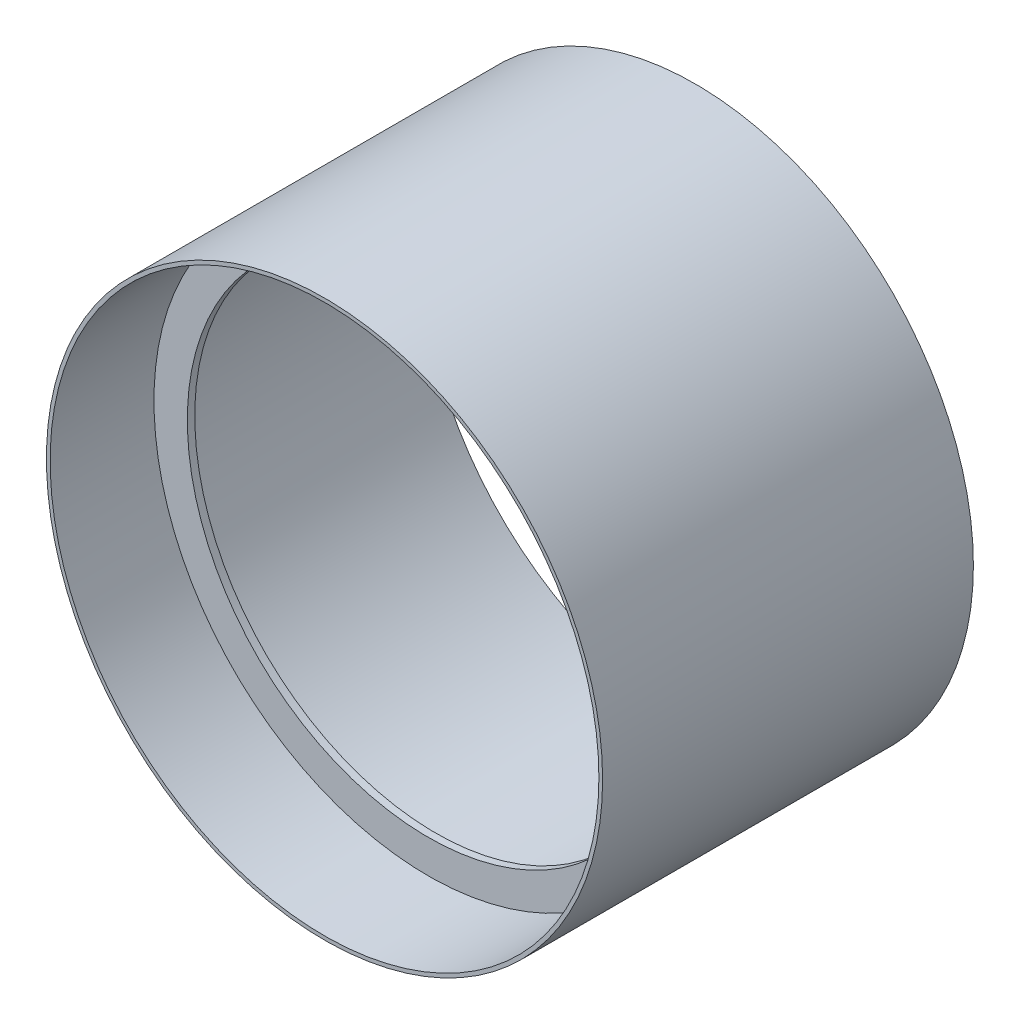
from build123d import *

# Parameters (mm, degrees)
SKETCH_1_R      = 75
EXTRUDE_1_DEPTH = 100
SHELL_1_T       = -1
SKETCH_2_R      = 75
SKETCH_2_R_2    = 65
EXTRUDE_2_DEPTH = 2


with BuildPart() as part:
    # 草图1 → 凸台-拉伸1 (new body)
    with BuildSketch(Plane.XY):
        Circle(SKETCH_1_R)
    extrude(amount=EXTRUDE_1_DEPTH)

    # 抽壳1
    shell_1_openings = [part.faces().sort_by_distance(p)[0] for p in [
        (0, 0, 0),
        (0, 0, 100),
    ]]
    offset(amount=SHELL_1_T, openings=shell_1_openings, kind=Kind.INTERSECTION)

    # 草图2 → 凸台-拉伸2 (add)
    with BuildSketch(Plane.XY.offset(70)):
        Circle(SKETCH_2_R)
        Circle(SKETCH_2_R_2, mode=Mode.SUBTRACT)
    extrude(amount=EXTRUDE_2_DEPTH)


solid = part.part
